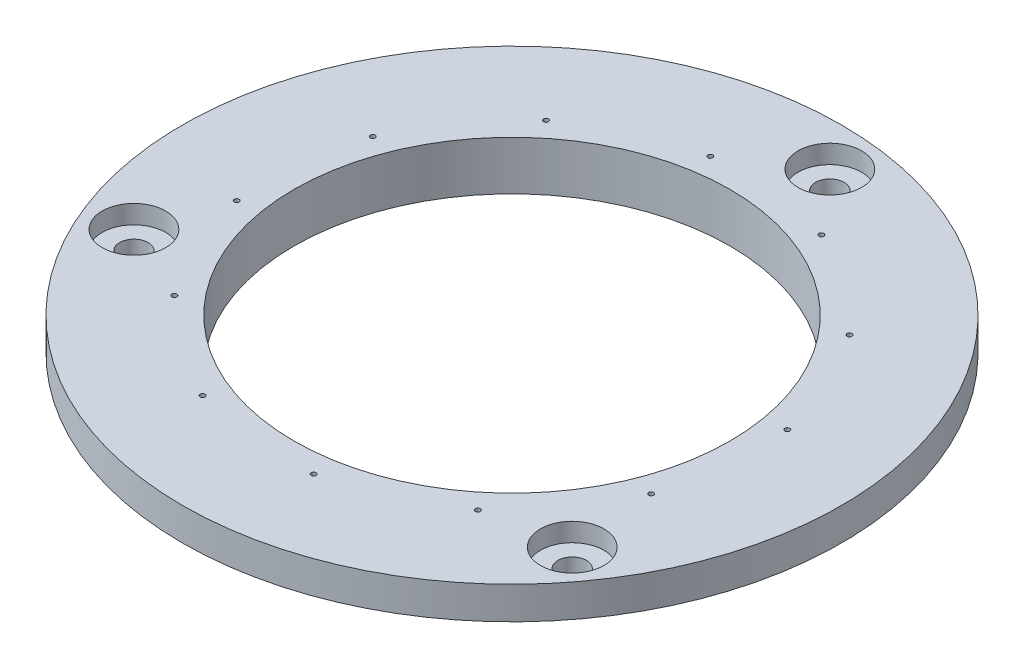
from build123d import *

# Parameters (mm, degrees)
SKETCH2_R                               = 63.5
SKETCH2_R_2                             = 42.0000049
BOSS_EXTRUDE1_DEPTH                     = 9.45
CBORE_FOR_M5_HEX_HEAD_BOLT1_D           = 5.5
CBORE_FOR_M5_HEX_HEAD_BOLT1_DEPTH       = 19.75
CBORE_FOR_M5_HEX_HEAD_BOLT1_CBORE_D     = 12.24
CBORE_FOR_M5_HEX_HEAD_BOLT1_CBORE_DEPTH = 3.58
CBORE_FOR_M5_HEX_HEAD_BOLT1_TIP         = 1.652366702
SKETCH27_W                              = 4.908836101
SKETCH27_H                              = 3.175
M1_2X0_25_TAPPED_HOLE1_D                = 0.95


with BuildPart() as part:
    # Sketch2 → Boss-Extrude1 (new body)
    with BuildSketch(Plane(origin=(0, 0, 0), x_dir=(1, 0, 0), z_dir=(0, 1, 0))):
        Circle(SKETCH2_R)
        Circle(SKETCH2_R_2, mode=Mode.SUBTRACT)
    extrude(amount=BOSS_EXTRUDE1_DEPTH)

    # CBORE for M5 Hex Head Bolt1
    with Locations(Plane(origin=(6.244, 9.45, -55), x_dir=(0, 0, 1), z_dir=(0, 1, 0))):
        with Locations((0, 0), (87.907462621, 38.265397208), (77.092537379, -56.997397208)):
            CounterBoreHole(CBORE_FOR_M5_HEX_HEAD_BOLT1_D / 2, CBORE_FOR_M5_HEX_HEAD_BOLT1_CBORE_D / 2, CBORE_FOR_M5_HEX_HEAD_BOLT1_CBORE_DEPTH, depth=CBORE_FOR_M5_HEX_HEAD_BOLT1_DEPTH)
            with Locations((0, 0, -(CBORE_FOR_M5_HEX_HEAD_BOLT1_DEPTH + CBORE_FOR_M5_HEX_HEAD_BOLT1_TIP / 2))):  # 118° drill point
                Cone(0, CBORE_FOR_M5_HEX_HEAD_BOLT1_D / 2, CBORE_FOR_M5_HEX_HEAD_BOLT1_TIP, mode=Mode.SUBTRACT)

    # Sketch27 → Cut-Revolve1 (revolve, cut)
    with BuildSketch(Plane.XY):
        with Locations((61.04558195, 1.5875)):
            Rectangle(SKETCH27_W, SKETCH27_H)
    revolve(axis=Axis((0, 0, 0), (0, 1, 0)), mode=Mode.SUBTRACT)

    # M1.2x0.25 Tapped Hole1 (through all)
    with Locations(Plane(origin=(-17.102005156, 9.45, -64.29943571), x_dir=(0.10804572851125993, 0, -0.994145925179232), z_dir=(0, 1, 0))):
        with Locations((-95.006137406, 8.491131235), (-74.374081825, 20.610412233), (-50.44655706, 20.789989663), (-29.634924049, 8.981745897), (-17.515643051, -11.650309684), (-17.336065621, -35.577834449), (-29.144309387, -56.389467459), (-49.776364968, -68.508748458), (-73.703889733, -68.688325887), (-94.515522744, -56.880082121), (-106.634803742, -36.24802654), (-106.814381172, -12.320501776)):
            Hole(M1_2X0_25_TAPPED_HOLE1_D / 2)


solid = part.part
